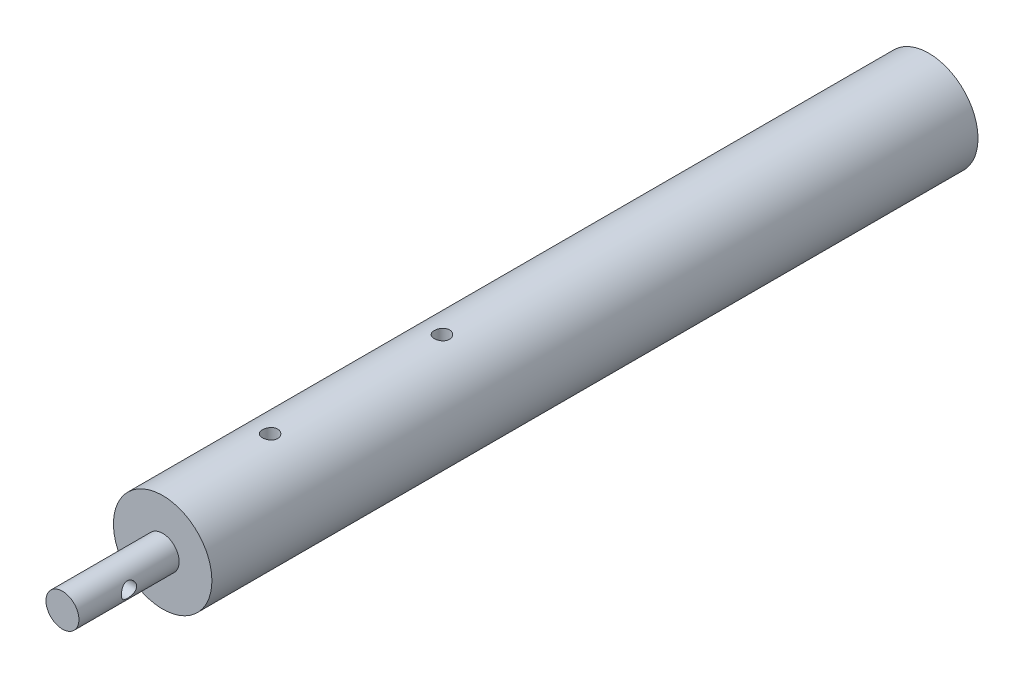
from build123d import *

# Parameters (mm, degrees)
SKETCH1_R             = 8.73125
BOSS_EXTRUDE1_DEPTH   = 135.89
SKETCH2_R             = 2.921
BOSS_EXTRUDE2_DEPTH   = 17.78
F_6_32_TAPPED_HOLE1_D = 2.7051
F_6_32_TAPPED_HOLE2_D = 2.7051


with BuildPart() as part:
    # Sketch1 → Boss-Extrude1 (new body)
    with BuildSketch(Plane.XY):
        Circle(SKETCH1_R)
    extrude(amount=BOSS_EXTRUDE1_DEPTH)

    # Sketch2 → Boss-Extrude2 (add)
    with BuildSketch(Plane.XY.offset(135.89)):
        Circle(SKETCH2_R)
    extrude(amount=BOSS_EXTRUDE2_DEPTH)

    # #6-32 Tapped Hole1 (through all)
    with Locations(Plane(origin=(0, 8.73125, 0), x_dir=(1, 0, 0), z_dir=(0, 1, 0))):
        with Locations((0, -86.36), (0, -116.84)):
            Hole(F_6_32_TAPPED_HOLE1_D / 2)

    # #6-32 Tapped Hole2 (through all)
    with Locations(Plane(origin=(2.921, 0, 0), x_dir=(0, 0, -1), z_dir=(1, 0, 0))):
        with Locations((-144.78, 0)):
            Hole(F_6_32_TAPPED_HOLE2_D / 2)


solid = part.part
